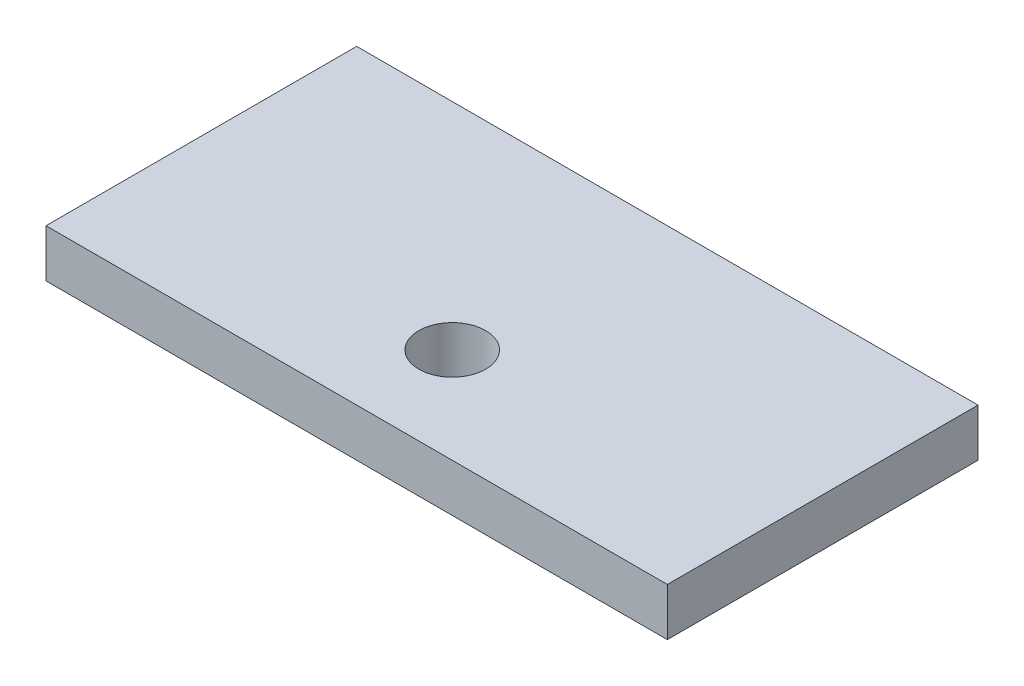
from build123d import *

# Parameters (mm, degrees)
SKETCH1_W               = 130
SKETCH1_H               = 65
BOSS_EXTRUDE1_DEPTH     = 10
CUT_EXTRUDE2_DEPTH      = 74.357003756
CUT_EXTRUDE2_DEPTH_BACK = 74.357003756
SKETCH2_R               = 7


with BuildPart() as part:
    # Sketch1 → Boss-Extrude1 (new body)
    with BuildSketch(Plane(origin=(0, 0, 0), x_dir=(1, 0, 0), z_dir=(0, 1, 0))):
        Rectangle(SKETCH1_W, SKETCH1_H)
    extrude(amount=BOSS_EXTRUDE1_DEPTH)

    # Sketch2 → Cut-Extrude2 (cut, two sides: drawn at the far end of the back side and taken through both)
    with BuildSketch(Plane(origin=(0, 0, 0), x_dir=(1, 0, 0), z_dir=(0, 1, 0)).offset(-CUT_EXTRUDE2_DEPTH_BACK)):
        with Locations((0, -12.5)):
            Circle(SKETCH2_R)
    extrude(amount=CUT_EXTRUDE2_DEPTH + CUT_EXTRUDE2_DEPTH_BACK, mode=Mode.SUBTRACT)


solid = part.part
